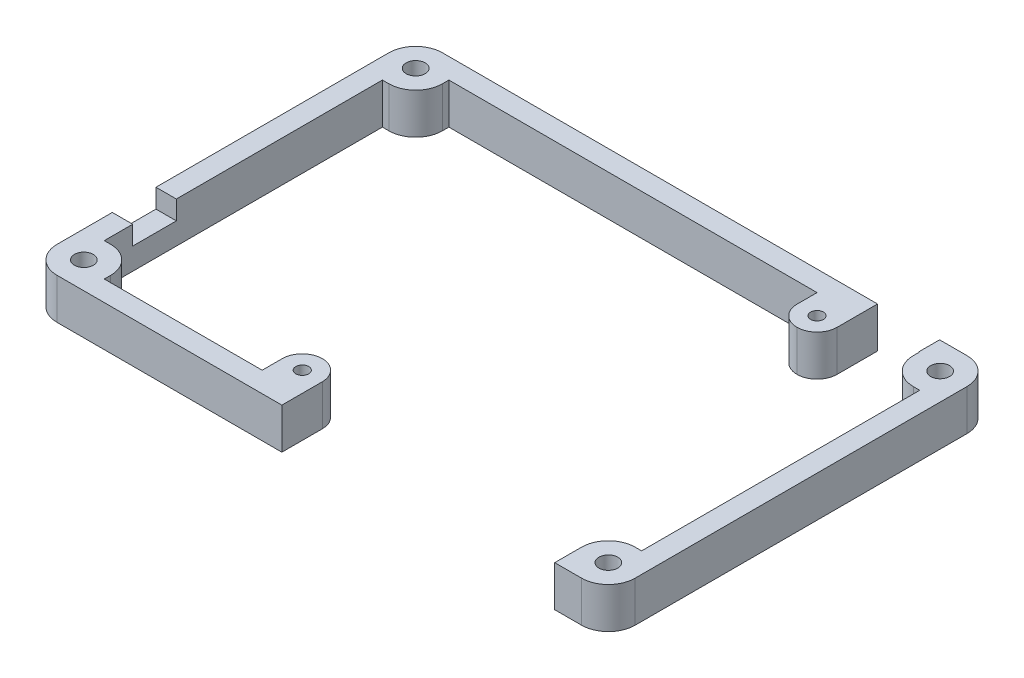
from build123d import *

# Parameters (mm, degrees)
BOSS_EXTRUDE3_DEPTH = 6.35
SKETCH3_W           = 9.663283239
SKETCH3_H           = 6.35
CUT_EXTRUDE1_DEPTH  = 3.175
SKETCH4_W           = 42.475
SKETCH4_H           = 6.35
CUT_EXTRUDE2_DEPTH  = 8.35
SKETCH5_W           = 6.8
SKETCH5_H           = 5.9
CUT_EXTRUDE3_DEPTH  = 3.175
SKETCH7_R           = 1.4732
CUT_EXTRUDE4_DEPTH  = 10
SKETCH10_W          = 6.24
SKETCH10_H          = 6.35
BOSS_EXTRUDE4_DEPTH = 6.24
SKETCH11_W          = 6.24
SKETCH11_H          = 6.35
BOSS_EXTRUDE5_DEPTH = 6.24
SKETCH12_R          = 1
CUT_EXTRUDE5_DEPTH  = 55.454774814
SKETCH13_R          = 1
CUT_EXTRUDE6_DEPTH  = 55.454774814
FILLET1_R           = 3.12


with BuildPart() as part:
    # Sketch2 → Boss-Extrude3 (new body)
    with BuildSketch(Plane(origin=(0, 0, 0), x_dir=(1, 0, 0), z_dir=(0, 1, 0))):
        with BuildLine():
            Line((-45, 25.825), (-45, -25.825))
            ThreePointArc((-45, -25.825), (-43.777170811, -28.777170811), (-40.825, -30))
            Line((-40.825, -30), (40.825, -30))
            ThreePointArc((40.825, -30), (43.777170811, -28.777170811), (45, -25.825))
            Line((45, -25.825), (45, 25.825))
            ThreePointArc((45, 25.825), (43.777170811, 28.777170811), (40.825, 30))
            Line((40.825, 30), (-40.825, 30))
            ThreePointArc((-40.825, 30), (-43.777170811, 28.777170811), (-45, 25.825))
        make_face()
        with BuildLine():
            Line((40.825, 21.65), (41.825, 21.65))
            Line((41.825, 21.65), (41.825, -21.65))
            Line((41.825, -21.65), (40.825, -21.65))
            ThreePointArc((40.825, -21.65), (37.872829189, -22.872829189), (36.65, -25.825))
            Line((36.65, -25.825), (36.65, -26.825))
            Line((36.65, -26.825), (-36.65, -26.825))
            Line((-36.65, -26.825), (-36.65, -25.825))
            ThreePointArc((-36.65, -25.825), (-37.872829189, -22.872829189), (-40.825, -21.65))
            Line((-40.825, -21.65), (-41.825, -21.65))
            Line((-41.825, -21.65), (-41.825, 21.65))
            Line((-41.825, 21.65), (-40.825, 21.65))
            ThreePointArc((-40.825, 21.65), (-37.872829189, 22.872829189), (-36.65, 25.825))
            Line((-36.65, 25.825), (-36.65, 26.825))
            Line((-36.65, 26.825), (36.65, 26.825))
            Line((36.65, 26.825), (36.65, 25.825))
            ThreePointArc((36.65, 25.825), (37.872829189, 22.872829189), (40.825, 21.65))
        make_face(mode=Mode.SUBTRACT)
    extrude(amount=BOSS_EXTRUDE3_DEPTH)

    # Sketch3 → Cut-Extrude1 (cut)
    with BuildSketch(Plane(origin=(0, 0, -30), x_dir=(-1, 0, 0), z_dir=(0, 0, -1))):
        with Locations((-31.734329903, 3.175)):
            Rectangle(SKETCH3_W, SKETCH3_H)
    extrude(amount=-CUT_EXTRUDE1_DEPTH, mode=Mode.SUBTRACT)

    # Sketch4 → Cut-Extrude2 (cut)
    with BuildSketch(Plane.XY.offset(30)):
        with Locations((15.4125, 3.175)):
            Rectangle(SKETCH4_W, SKETCH4_H)
    extrude(amount=-CUT_EXTRUDE2_DEPTH, mode=Mode.SUBTRACT)


with BuildPart() as cut_extrude2_piece_1:
    # of the separate pieces the step leaves, piece 1, a body of its own (cut_extrude2_pieces)
    add(part.part.solids().sort_by_distance((-40.825, 0, 30))[0])

    # Sketch5 → Cut-Extrude3 (cut)
    with BuildSketch(Plane.ZY.offset(45)):
        with Locations((13.825, 6.35)):
            Rectangle(SKETCH5_W, SKETCH5_H)
    extrude(amount=-CUT_EXTRUDE3_DEPTH, mode=Mode.SUBTRACT)


with BuildPart() as cut_extrude2_piece_2:
    # of the separate pieces the step leaves, piece 2, a body of its own (cut_extrude2_pieces)
    add(part.part.solids().sort_by_distance((40.825, 0, -30))[0])


with BuildPart() as cut_extrude4_tool:
    # Sketch7 → Cut-Extrude4 (new body)
    with BuildSketch(Plane.XZ):
        with Locations(Location((-40.825, -25.825, 0), (0, 0, 270))):
            Circle(SKETCH7_R)
        with Locations(Location((-40.825, 25.825, 0), (0, 0, 270))):
            Circle(SKETCH7_R)
        with Locations(Location((40.825, 25.825, 0), (0, 0, 270))):
            Circle(SKETCH7_R)
        with Locations(Location((40.825, -25.825, 0), (0, 0, 270))):
            Circle(SKETCH7_R)
    extrude(amount=-CUT_EXTRUDE4_DEPTH)


with BuildPart() as cut_extrude2_piece_1_1:
    add(cut_extrude2_piece_1.part)

    # Cut-Extrude4: cut by cut_extrude4_tool
    add(cut_extrude4_tool.part, mode=Mode.SUBTRACT)

    # Sketch10 → Boss-Extrude4 (add)
    with BuildSketch(Plane(origin=(0, 0, 26.825), x_dir=(-1, 0, 0), z_dir=(0, 0, -1))):
        with Locations((8.945, 3.175)):
            Rectangle(SKETCH10_W, SKETCH10_H)
    extrude(amount=BOSS_EXTRUDE4_DEPTH)

    # Sketch11 → Boss-Extrude5 (add)
    with BuildSketch(Plane.XY.offset(-26.825)):
        with Locations((23.782688283, 3.175)):
            Rectangle(SKETCH11_W, SKETCH11_H)
    extrude(amount=BOSS_EXTRUDE5_DEPTH)

    # Sketch12 → Cut-Extrude5 (cut, through all)
    with BuildSketch(Plane(origin=(0, 6.35, 0), x_dir=(1, 0, 0), z_dir=(0, 1, 0))):
        with Locations(Location((23.782688283, 23.705, 0), (0, 0, 270))):
            Circle(SKETCH12_R)
    extrude(amount=-CUT_EXTRUDE5_DEPTH, mode=Mode.SUBTRACT)

    # Sketch13 → Cut-Extrude6 (cut, through all)
    with BuildSketch(Plane(origin=(0, 6.35, 0), x_dir=(1, 0, 0), z_dir=(0, 1, 0))):
        with Locations(Location((-8.945, -23.705, 0), (0, 0, 270))):
            Circle(SKETCH13_R)
    extrude(amount=-CUT_EXTRUDE6_DEPTH, mode=Mode.SUBTRACT)

    # Fillet1
    fillet1_edges = [cut_extrude2_piece_1_1.edges().sort_by_distance(p)[0] for p in [
        (26.902688283, 3.175, -20.585),
        (20.662688283, 3.175, -20.585),
        (-5.825, 3.175, 20.585),
        (-12.065, 3.175, 20.585),
    ]]
    fillet(fillet1_edges, radius=FILLET1_R - 0.0001)  # a hair under: the kernel refuses the full size


with BuildPart() as cut_extrude2_piece_2_1:
    add(cut_extrude2_piece_2.part)

    # Cut-Extrude4: cut by cut_extrude4_tool
    add(cut_extrude4_tool.part, mode=Mode.SUBTRACT)


solid = Compound([cut_extrude2_piece_1_1.part, cut_extrude2_piece_2_1.part])
